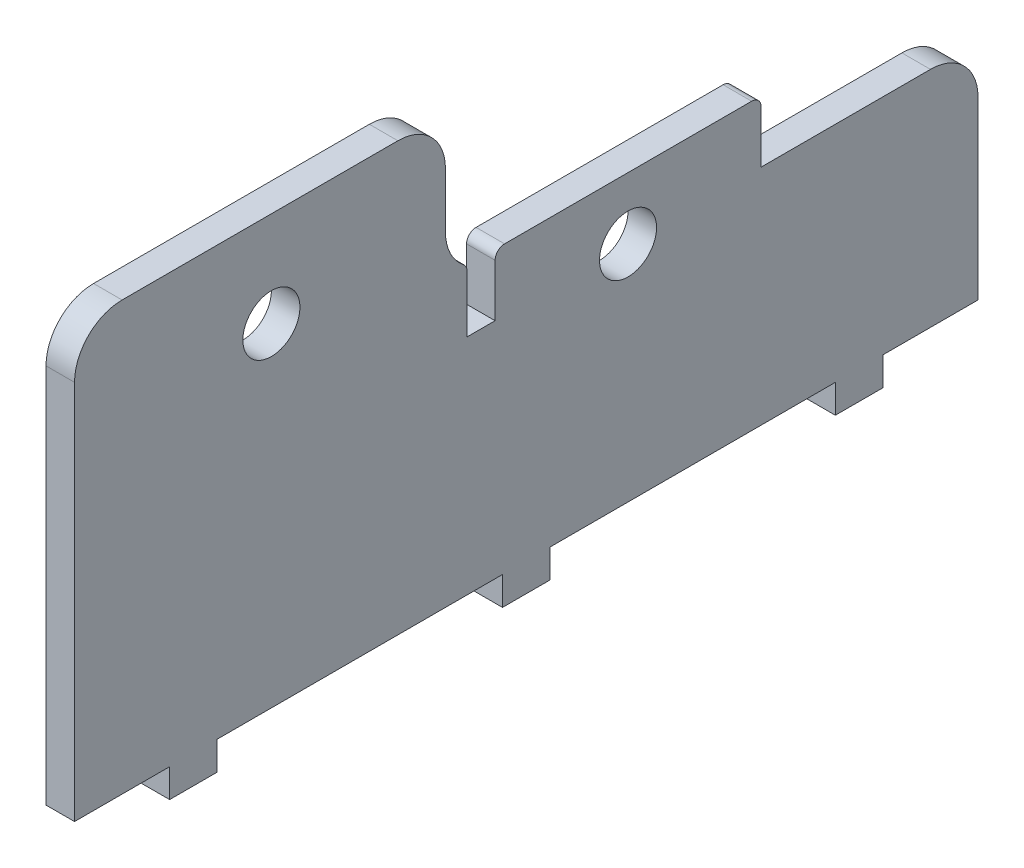
from build123d import *

# Parameters (mm, degrees)
SKETCH1_W           = 95
SKETCH1_H           = 30
BOSS_EXTRUDE1_DEPTH = 3
SKETCH4_W           = 3
SKETCH4_H           = 5
BOSS_EXTRUDE2_DEPTH = 3
SKETCH5_W           = 3
SKETCH5_H           = 39
BOSS_EXTRUDE3_DEPTH = 15
SKETCH2_R           = 3
CUT_EXTRUDE1_DEPTH  = 80.113842025
LPATTERN1_COUNT     = 3
LPATTERN1_PITCH     = 35
SKETCH6_W           = 2.95
SKETCH6_H           = 8.706192548
SKETCH6_W_2         = 22.8
SKETCH6_H_2         = 6.5
CUT_EXTRUDE2_DEPTH  = 80.113842025
FILLET3_R           = 5
FILLET4_R           = 1


with BuildPart() as part:
    # Sketch1 → Boss-Extrude1 (new body)
    with BuildSketch(Plane(origin=(0, 0, 0), x_dir=(0, 0, -1), z_dir=(1, 0, 0))):
        with Locations((17.5, 15)):
            Rectangle(SKETCH1_W, SKETCH1_H)
    extrude(amount=BOSS_EXTRUDE1_DEPTH)

    # Sketch4 → Boss-Extrude2 (add)
    with BuildSketch(Plane(origin=(0, 0, 0), x_dir=(1, 0, 0), z_dir=(0, 1, 0))):
        with Locations((1.5, -17.5)):
            Rectangle(SKETCH4_W, SKETCH4_H)
    boss_extrude2 = extrude(amount=-BOSS_EXTRUDE2_DEPTH)

    # Sketch5 → Boss-Extrude3 (add)
    with BuildSketch(Plane(origin=(0, 30, 0), x_dir=(1, 0, 0), z_dir=(0, 1, 0))):
        with Locations((1.5, -10.5)):
            Rectangle(SKETCH5_W, SKETCH5_H)
    extrude(amount=BOSS_EXTRUDE3_DEPTH)

    # Sketch2 → Cut-Extrude1 (cut, through all)
    with BuildSketch(Plane(origin=(3, 0, 0), x_dir=(0, 0, -1), z_dir=(1, 0, 0))):
        with Locations((28.2, 23.5)):
            Circle(SKETCH2_R)
        with Locations((-9.3, 35)):
            Circle(SKETCH2_R)
    extrude(amount=-CUT_EXTRUDE1_DEPTH, mode=Mode.SUBTRACT)

    # LPattern1: Boss-Extrude2 ×3
    with Locations(*[(0, 0, -i * LPATTERN1_PITCH) for i in range(1, LPATTERN1_COUNT)]):
        add(boss_extrude2)

    # Sketch6 → Cut-Extrude2 (cut, through all)
    with BuildSketch(Plane(origin=(3, 0, 0), x_dir=(0, 0, -1), z_dir=(1, 0, 0))):
        with Locations((12.746364518, 27.853096274)):
            Rectangle(SKETCH6_W, SKETCH6_H)
        with Locations((53.6, 26.75)):
            Rectangle(SKETCH6_W_2, SKETCH6_H_2)
    extrude(amount=-CUT_EXTRUDE2_DEPTH, mode=Mode.SUBTRACT)

    # Fillet3
    # the kernel refuses this fillet: 5 mm, written as the material it adds along each edge
    with BuildSketch(Plane(origin=(0, 30, -9), x_dir=(0, 1.1824837095993706e-12, -1.0), z_dir=(1, 0, 0))) as fillet3_piece_1:
        with BuildLine():
            CenterArc((5, 4.189814842), FILLET3_R, 180, 56.925635132)
            Line((0, 4.189814842), (0, 0))
            Line((0, 0), (2.271364518, 0))
        make_face()
    extrude(amount=3)
    # the kernel refuses this fillet: 5 mm, written as the material it takes off along each edge
    with BuildSketch(Plane(origin=(15.5, 45, 30), x_dir=(0, 0, -1), z_dir=(-1, 0, 0)), Plane(origin=(15.5, 23.5, -65), x_dir=(0, -1, 0), z_dir=(-1, 0, 0))) as fillet3_2_piece_1:
        with BuildLine():
            CenterArc((FILLET3_R, FILLET3_R), FILLET3_R, 180, 90)
            Line((0, FILLET3_R), (0, 0))
            Line((0, 0), (FILLET3_R, 0))
        make_face()
    extrude(amount=28, mode=Mode.SUBTRACT)
    with BuildSketch(Plane(origin=(-12.5, 45, -9), x_dir=(0, -1, 0), z_dir=(1, 0, 0))) as fillet3_2_piece_2:
        with BuildLine():
            CenterArc((FILLET3_R, -FILLET3_R), FILLET3_R, 90, 90)
            Line((0, -FILLET3_R), (0, 0))
            Line((0, 0), (FILLET3_R, 0))
        make_face()
    extrude(amount=28, mode=Mode.SUBTRACT)

    # Fillet4
    fillet4_edges = [part.edges().sort_by_distance(p)[0] for p in [
        (1.5, 30, -11.271364518),
        (1.5, 30, -14.221364518),
        (1.5, 30, -42.2),
    ]]
    fillet(fillet4_edges, radius=FILLET4_R)


solid = part.part
